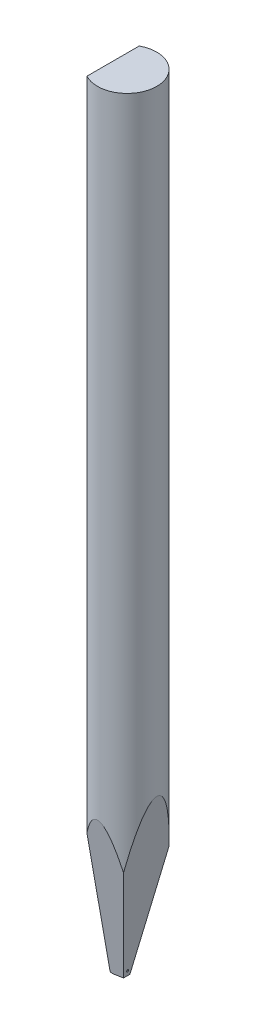
from build123d import *

# Parameters (mm, degrees)
TD_SKETCH_R                             = 0.79248
TL_FEATURE_DEPTH                        = 21.0312
TDF_STD_SKETCH_W                        = 2.09296
TDF_STD_SKETCH_H                        = 2.09296
TDF_STD_FEATURE_DEPTH                   = 22.061040395
ISA_20_STD_FEATURE_DEPTH                = 22.061040395
ISA_20_STD_FEATURE_DEPTH_BACK           = 22.061040395
F_10BA_STD_FEATURE_DEPTH                = 22.061040395
F_10BA_STD_FEATURE_DEPTH_BACK           = 22.061040395
FRO_STD_FEATURE_DEPTH                   = 22.061040395
FRO_STD_FEATURE_DEPTH_BACK              = 22.061040395
C_STD_FEATURE_DEPTH                     = 22.061040395
C_STD_FEATURE_DEPTH_BACK                = 22.061040395
ERW_STD_FEATURE_DEPTH                   = 0.01905
H_STD_FEATURE_REACH                     = 22.896
H_STD_SKETCH_R                          = 0.01905
H_STD_SKETCH_3_R                        = 0.01905
FUNNEL_FINAL_DIAMETRE_STD_FEATURE_DEPTH = 2.499995
FUNNEL_FINAL_DIAMETRE_STD_FEATURE_DRAFT = -13
ROUND_BR_STD_FEATURE_START              = -1
ROUND_BR_STD_FEATURE_DEPTH              = 1.009339363


with BuildPart() as part:
    # TD_sketch → TL_feature (new body)
    with BuildSketch(Plane(origin=(0, 0, 0), x_dir=(1, 0, 0), z_dir=(0, 1, 0))):
        with Locations(Location((0, 0, 0), (0, 0, 270))):
            Circle(TD_SKETCH_R)
    extrude(amount=TL_FEATURE_DEPTH)

    # TDF_STD_sketch → TDF_STD_feature (cut, through all)
    with BuildSketch(Plane(origin=(0, 0, 0), x_dir=(1, 0, 0), z_dir=(0, 1, 0))):
        with Locations((-1.4224, 0)):
            Rectangle(TDF_STD_SKETCH_W, TDF_STD_SKETCH_H)
    extrude(amount=TDF_STD_FEATURE_DEPTH, mode=Mode.SUBTRACT)

    # ISA_20_STD_sketch → ISA_20_STD_feature (cut, two sides: drawn at the far end of the back side and taken through both)
    with BuildSketch(Plane(origin=(0, 0, 0), x_dir=(0, 0, -1), z_dir=(1, 0, 0)).offset(-ISA_20_STD_FEATURE_DEPTH_BACK)):
        Polygon((-12.996080373, 73.27228267), (-3.784567997, 21.0312), (-0.0762, 0), (0.0762, 0), (3.784567997, 21.0312), (12.996080373, 73.27228267), (12.996080373, -32.821688483), (-12.996080373, -32.821688483), align=None)
    extrude(amount=ISA_20_STD_FEATURE_DEPTH + ISA_20_STD_FEATURE_DEPTH_BACK, mode=Mode.SUBTRACT)

    # 10BA_STD_sketch → 10BA_STD_feature (cut, two sides: drawn at the far end of the back side and taken through both)
    with BuildSketch(Plane.XY.offset(-F_10BA_STD_FEATURE_DEPTH_BACK)):
        Polygon((-53.216424634, 0), (-0.37592, 0), (-0.29972, 0), (-0.011354365, 0.050846642), (3.688047997, 21.0312), (12.863705333, 73.068938636), (91.245889802, 2.18375769), (25.165759835, -70.885180946), align=None)
    extrude(amount=F_10BA_STD_FEATURE_DEPTH + F_10BA_STD_FEATURE_DEPTH_BACK, mode=Mode.SUBTRACT)

    # FRO_STD_sketch → FRO_STD_feature (cut, two sides: drawn at the far end of the back side and taken through both)
    with BuildSketch(Plane.XY.offset(-FRO_STD_FEATURE_DEPTH_BACK)):
        with BuildLine():
            Line((-0.37592, 52.152138388), (-0.37592, 0.02794))
            ThreePointArc((-0.37592, 0.02794), (-0.367736563, 0.008183437), (-0.34798, 0))
            Line((-0.34798, 0), (51.776218388, 0))
            Line((51.776218388, 0), (-21.9385299, -73.714748288))
            Line((-21.9385299, -73.714748288), (-74.090668288, -21.5626099))
            Line((-74.090668288, -21.5626099), (-0.37592, 52.152138388))
        make_face()
    extrude(amount=FRO_STD_FEATURE_DEPTH + FRO_STD_FEATURE_DEPTH_BACK, mode=Mode.SUBTRACT)

    # C_STD_sketch → C_STD_feature (cut, two sides: drawn at the far end of the back side and taken through both)
    with BuildSketch(Plane(origin=(0, 0, 0), x_dir=(0, 0, -1), z_dir=(1, 0, 0)).offset(-C_STD_FEATURE_DEPTH_BACK)):
        with BuildLine():
            Line((-50.530423385, -12.791040855), (-0.030559272, 0))
            ThreePointArc((-0.030559272, 0), (0, 0.00381), (0.030559272, 0))
            Line((0.030559272, 0), (50.530423385, -12.791040855))
            Line((50.530423385, -12.791040855), (50.530423385, -116.980234183))
            Line((50.530423385, -116.980234183), (-50.530423385, -116.980234183))
            Line((-50.530423385, -116.980234183), (-50.530423385, -12.791040855))
        make_face()
    extrude(amount=C_STD_FEATURE_DEPTH + C_STD_FEATURE_DEPTH_BACK, mode=Mode.SUBTRACT)


with BuildPart() as body_2:
    # ERW_STD_sketch → ERW_STD_feature (new, symmetric)
    with BuildSketch(Plane.XY):
        Polygon((-0.1397, 0.09144), (-0.1397, 0), (-0.32512, 0), (-0.272327091, 0.09144), align=None)
    extrude(amount=ERW_STD_FEATURE_DEPTH, both=True)

    # H_STD_sketch → H_STD_feature (add, up to next)
    with BuildSketch(Plane(origin=(-0.010357492, 0.166115932, 0), x_dir=(0, 0, -1), z_dir=(0.8660254037844415, 0.4999999999999953, 0)), mode=Mode.PRIVATE) as h_std_feature_sk1:
        with Locations(Location((0, 0, 0), (0, 0, 90))):
            Circle(H_STD_SKETCH_R)
    h_std_feature_tool1 = extrude(h_std_feature_sk1.sketch, amount=-H_STD_FEATURE_REACH, mode=Mode.PRIVATE) - body_2.part
    add(h_std_feature_tool1.solids().sort_by_distance((-0.010357, 0.166116, 0))[0])


with BuildPart() as funnel_final_diametre_std_feature_tool:
    # H_STD_sketch<3> → funnel_final_diametre_STD_feature (with draft: the straight prism first)
    with BuildSketch(Plane(origin=(-0.010357492, 0.166115932, 0), x_dir=(0, 0, -1), z_dir=(0.8660254037844415, 0.4999999999999953, 0))):
        with Locations(Location((0, 0, 0), (0, 0, 90))):
            Circle(H_STD_SKETCH_3_R)
    extrude(amount=FUNNEL_FINAL_DIAMETRE_STD_FEATURE_DEPTH)
    # funnel_final_diametre_STD_feature: the draft: its side faces are tilted about the plane it starts from
    funnel_final_diametre_std_feature_sides = [funnel_final_diametre_std_feature_tool.faces().sort_by_distance(p)[0] for p in [
        (1.081697098, 0.774616898, 0),
    ]]
    draft(funnel_final_diametre_std_feature_sides, Plane(origin=(-0.010357492, 0.166115932, 0), x_dir=(0, 0, -1), z_dir=(0.8660254037844415, 0.4999999999999953, 0)), FUNNEL_FINAL_DIAMETRE_STD_FEATURE_DRAFT)


with BuildPart() as body_2_1:
    add(body_2.part)

    # funnel_final_diametre_STD_feature: add funnel_final_diametre_std_feature_tool
    add(funnel_final_diametre_std_feature_tool.part)

    # ROUND_BR_STD_feature: read off the stored shape, not the designer's step
    # ROUND_BR_STD_feature outline → ROUND_BR_STD_feature (cut)
    with BuildSketch(Plane(origin=(0, 0, 0), x_dir=(0.8660254037844362, -0.5000000000000042, 0), z_dir=(0.5000000000000042, 0.8660254037844363, 0)).offset(ROUND_BR_STD_FEATURE_START)):
        with BuildLine():
            Line((-0.281562179, -0.01905), (-0.262512179, -0.01905))
            ThreePointArc((-0.262512179, -0.01905), (-0.275982563, -0.013470384), (-0.281562179, 0))
            Line((-0.281562179, 0), (-0.281562179, -0.01905))
        make_face()
        with BuildLine():
            Line((-0.281562179, 0.01905), (-0.281562179, 0))
            ThreePointArc((-0.281562179, 0), (-0.275982563, 0.013470384), (-0.262512179, 0.01905))
            Line((-0.262512179, 0.01905), (-0.281562179, 0.01905))
        make_face()
    extrude(amount=ROUND_BR_STD_FEATURE_DEPTH, mode=Mode.SUBTRACT)


with BuildPart() as part_1:
    add(part.part)

    # COMBINE_STD_feature: cut body 2
    add(body_2_1.part, mode=Mode.SUBTRACT)


solid = part_1.part
